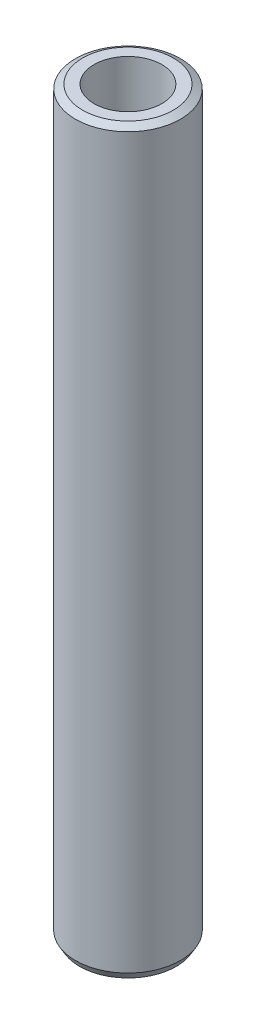
from build123d import *
from OCP.BRepFilletAPI import BRepFilletAPI_MakeChamfer

# Parameters (mm, degrees)
SKETCH1_R           = 20
BOSS_EXTRUDE1_DEPTH = 281.699628852
SKETCH2_R           = 12.908073916
CUT_EXTRUDE1_DEPTH  = 284.116020203
CHAMFER1_SIZE       = 1.585135692
CHAMFER1_SIZE2      = 2.745535555


with BuildPart() as part:
    # Sketch1 → Boss-Extrude1 (new body)
    with BuildSketch(Plane(origin=(0, 0, 0), x_dir=(1, 0, 0), z_dir=(0, 1, 0))):
        Circle(SKETCH1_R)
    extrude(amount=BOSS_EXTRUDE1_DEPTH)

    # Sketch2 → Cut-Extrude1 (cut, through all)
    with BuildSketch(Plane(origin=(0, 0, 0), x_dir=(1, 0, 0), z_dir=(0, 1, 0))):
        Circle(SKETCH2_R)
    extrude(amount=CUT_EXTRUDE1_DEPTH, mode=Mode.SUBTRACT)

    # Chamfer1: one chamfer whose edges measure the first distance from different faces: ONE call of the kernel's chamfer builder (chamfer() names one face for all edges)
    chamfer1_edges_1 = [part.edges().sort_by_distance(p)[0] for p in [
        (-20, 281.699628852, 0),
    ]]
    chamfer1_side_1 = [part.faces().sort_by_distance(p)[0] for p in [
        (-20, 140.849814426, 0),
    ]]
    chamfer1_edges_2 = [part.edges().sort_by_distance(p)[0] for p in [
        (-20, 0, 0),
    ]]
    chamfer1_side_2 = [part.faces().sort_by_distance(p)[0] for p in [
        (-19.434314575, 0, 0),
    ]]
    chamfer1 = BRepFilletAPI_MakeChamfer(part.part.solid().wrapped)
    for e in chamfer1_edges_1:
        chamfer1.Add(CHAMFER1_SIZE, CHAMFER1_SIZE2, e.wrapped, chamfer1_side_1[0].wrapped)  # the first distance lies on this face
    for e in chamfer1_edges_2:
        chamfer1.Add(CHAMFER1_SIZE, CHAMFER1_SIZE2, e.wrapped, chamfer1_side_2[0].wrapped)  # the first distance lies on this face
    add(Compound.cast(chamfer1.Shape()), mode=Mode.REPLACE)


solid = part.part
